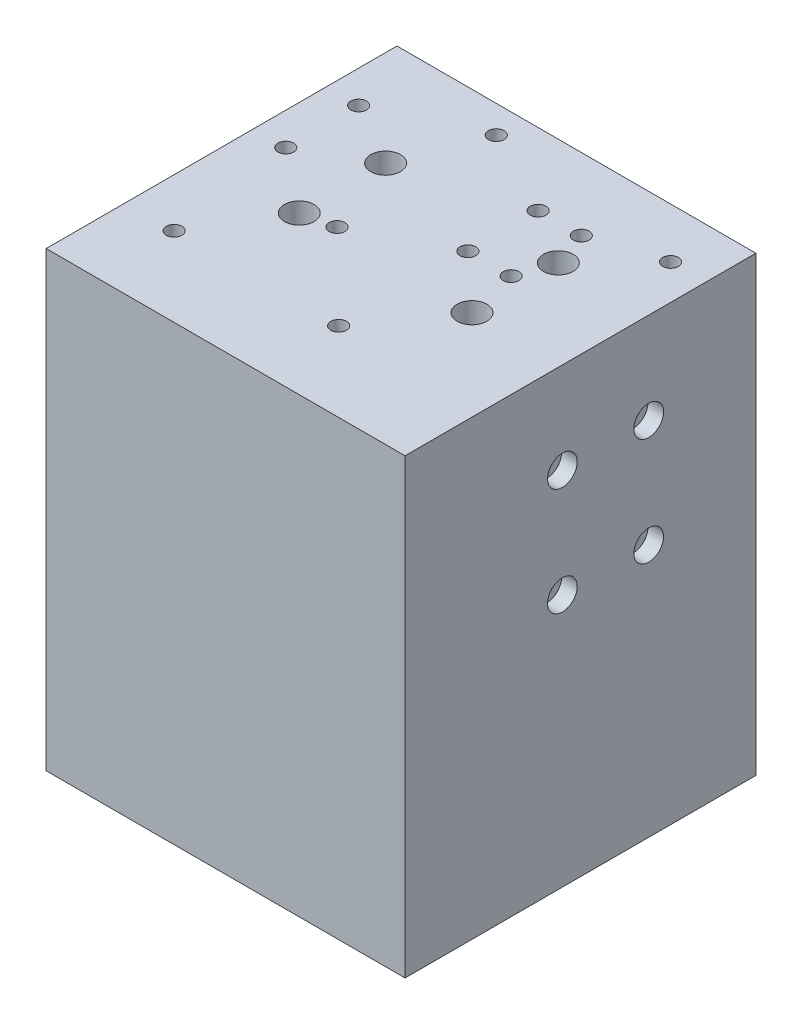
from build123d import *

# Parameters (mm, degrees)
EXTRUDE_1_DEPTH                 = 60
SKETCH_3_W                      = 44.3
SKETCH_3_H                      = 33.8
CUT_EXTRUDE_1_DEPTH             = 56.5
SKETCH_4_W                      = 75
SKETCH_4_H                      = 30
EXTRUDE_2_DEPTH                 = 66
SKETCH_5_W                      = 59.221662283
SKETCH_5_H                      = 50
CUT_EXTRUDE_2_DEPTH             = 65
SKETCH_34_W                     = 75
SKETCH_34_H                     = 30
EXTRUDE_5_DEPTH                 = 0.5
HOLE_WIZARD_M3_1_AT_2_COUNT     = 2
HOLE_WIZARD_M3_1_AT_2_PITCH     = 21
HOLE_WIZARD_M3_1_AT_3_COUNT     = 2
HOLE_WIZARD_M3_1_AT_3_PITCH     = 24.186773245
HOLE_WIZARD_M3_1_AT_4_COUNT     = 2
HOLE_WIZARD_M3_1_AT_4_PITCH     = 12
SKETCH_9_W                      = 201.131722391
SKETCH_9_H                      = 182.70094424
CUT_EXTRUDE_3_DEPTH             = 10
SKETCH_10_W                     = 66.5
SKETCH_10_H                     = 50
CUT_EXTRUDE_4_DEPTH             = 1.2
HOLE_WIZARD_M2_5_1_D            = 2.7
HOLE_WIZARD_M2_5_1_CBORE_D      = 5.5
HOLE_WIZARD_M2_5_1_CBORE_DEPTH  = 2.9
EXTRUDE_3_DEPTH                 = 12
SKETCH_16_W                     = 66.5
SKETCH_16_H                     = 53.8
EXTRUDE_4_DEPTH                 = 3
HOLE_WIZARD_M2_5_2_D            = 2.7
HOLE_WIZARD_M2_5_2_DEPTH        = 10
HOLE_WIZARD_M2_5_2_CBORE_D      = 5.5
HOLE_WIZARD_M2_5_2_CBORE_DEPTH  = 5
HOLE_START                      = -61.2
HOLE_WIZARD_2_9_2_9_1_OUTLINE_R = 1.45
HOLE_WIZARD_2_9_2_9_1_DEPTH     = 10
HOLE_START_2                    = -56.2
HOLE_WIZARD_2_9_2_9_2_OUTLINE_R = 1.45
HOLE_WIZARD_2_9_2_9_2_DEPTH     = 5
HOLE_WIZARD_2_9_2_9_4_D         = 2.9
HOLE_WIZARD_2_9_2_9_4_DEPTH     = 7
HOLE_WIZARD_2_9_2_9_4_TIP       = 0.871247898
CUT_EXTRUDE_5_REACH             = 165.928


# Read off the part's stored shape, not the designer's step: Ø2.9 (2.9) 直径孔1, Ø2.9 (2.9) 直径孔2, Ø2.9 (2.9) 直径孔3
with BuildPart() as part:
    # 草图2 → 凸台-拉伸1 (new body)
    with BuildSketch(Plane.XY):
        Polygon((0, 0), (15.232865332, 0), (15.232865332, -50), (66.5, -50), (66.5, -105), (0, -105), align=None)
    extrude(amount=EXTRUDE_1_DEPTH)

    # 草图3 → 切除-拉伸1 (cut)
    with BuildSketch(Plane.ZY):
        with Locations((37.85, -78.1)):
            Rectangle(SKETCH_3_W, SKETCH_3_H)
    extrude(amount=-CUT_EXTRUDE_1_DEPTH, mode=Mode.SUBTRACT)

    # 草图4 → 凸台-拉伸2 (add)
    with BuildSketch(Plane.ZY):
        with Locations((37.5, -120)):
            Rectangle(SKETCH_4_W, SKETCH_4_H)
    extrude(amount=-EXTRUDE_2_DEPTH)

    # 草图5 → 切除-拉伸2 (cut)
    with BuildSketch(Plane.XY.offset(60)):
        with Locations((-14.37796581, -25)):
            Rectangle(SKETCH_5_W, SKETCH_5_H)
    extrude(amount=-CUT_EXTRUDE_2_DEPTH, mode=Mode.SUBTRACT)

    # 草图34 → 凸台-拉伸5 (add)
    with BuildSketch(Plane(origin=(66, 0, 0), x_dir=(0, 0, -1), z_dir=(1, 0, 0))):
        with Locations((-37.5, -120)):
            Rectangle(SKETCH_34_W, SKETCH_34_H)
    extrude(amount=EXTRUDE_5_DEPTH)

    # 草图8 → M3 六角凹头螺钉的柱形沉头孔1 (revolve, cut)
    with BuildSketch(Plane(origin=(66, -108.3, 54.5), x_dir=(0, 0, -1), z_dir=(0, 1, 0))):
        Polygon((0, 0), (0, 66), (1.45, 66), (1.45, 60), (3.25, 60), (3.25, 0), align=None)
    hole_wizard_m3_1 = revolve(axis=Axis((72.35, -108.3, 54.5), (-1, 0, 0)), mode=Mode.SUBTRACT)

    # M3 六角凹头螺钉的柱形沉头孔1 at 2: M3 六角凹头螺钉的柱形沉头孔1 ×2
    with Locations(*[(0, 0, -i * HOLE_WIZARD_M3_1_AT_2_PITCH) for i in range(1, HOLE_WIZARD_M3_1_AT_2_COUNT)]):
        add(hole_wizard_m3_1, mode=Mode.SUBTRACT)

    # M3 六角凹头螺钉的柱形沉头孔1 at 3: M3 六角凹头螺钉的柱形沉头孔1 ×2
    with Locations(*[Vector(0, -0.4961389383568334, -0.8682431421244595) * (i * HOLE_WIZARD_M3_1_AT_3_PITCH) for i in range(1, HOLE_WIZARD_M3_1_AT_3_COUNT)]):
        add(hole_wizard_m3_1, mode=Mode.SUBTRACT)

    # M3 六角凹头螺钉的柱形沉头孔1 at 4: M3 六角凹头螺钉的柱形沉头孔1 ×2
    with Locations(*[(0, -i * HOLE_WIZARD_M3_1_AT_4_PITCH, 0) for i in range(1, HOLE_WIZARD_M3_1_AT_4_COUNT)]):
        add(hole_wizard_m3_1, mode=Mode.SUBTRACT)

    # 草图9 → 切除-拉伸3 (cut)
    with BuildSketch(Plane(origin=(0, 0, 0), x_dir=(-1, 0, 0), z_dir=(0, 0, -1))):
        with Locations((-9.064738267, -112.548341422)):
            Rectangle(SKETCH_9_W, SKETCH_9_H)
    extrude(amount=-CUT_EXTRUDE_3_DEPTH, mode=Mode.SUBTRACT)

    # 草图10 → 切除-拉伸4 (cut)
    with BuildSketch(Plane(origin=(0, -50, 0), x_dir=(1, 0, 0), z_dir=(0, 1, 0))):
        with Locations((33.25, -35)):
            Rectangle(SKETCH_10_W, SKETCH_10_H)
    extrude(amount=-CUT_EXTRUDE_4_DEPTH, mode=Mode.SUBTRACT)

    # M2.5 六角凹头螺钉的柱形沉头孔1 (through all)
    with Locations(Plane(origin=(66.5, 0, 0), x_dir=(0, 0, -1), z_dir=(1, 0, 0))):
        with Locations((-29.85, -68.1), (-45.85, -68.1), (-45.85, -88.1), (-29.85, -88.1)):
            CounterBoreHole(HOLE_WIZARD_M2_5_1_D / 2, HOLE_WIZARD_M2_5_1_CBORE_D / 2, HOLE_WIZARD_M2_5_1_CBORE_DEPTH)

    # 草图15 → 凸台-拉伸3 (add)
    with BuildSketch(Plane.XY.offset(60)):
        Polygon((66.5, -105), (66.5, -51.2), (0, -51.2), (0, -56.2), (46.5, -56.2), (46.5, -100), (0, -100), (0, -105), align=None)
    extrude(amount=EXTRUDE_3_DEPTH)

    # 草图16 → 凸台-拉伸4 (add)
    with BuildSketch(Plane.XY.offset(72)):
        with Locations((33.25, -78.1)):
            Rectangle(SKETCH_16_W, SKETCH_16_H)
    extrude(amount=EXTRUDE_4_DEPTH)

    # M2.5 六角凹头螺钉的柱形沉头孔2
    with Locations(Plane(origin=(0, -51.2, 0), x_dir=(1, 0, 0), z_dir=(0, 1, 0))):
        with Locations((17.75, -45.85), (17.75, -29.85), (49.75, -29.85), (49.75, -45.85)):
            CounterBoreHole(HOLE_WIZARD_M2_5_2_D / 2, HOLE_WIZARD_M2_5_2_CBORE_D / 2, HOLE_WIZARD_M2_5_2_CBORE_DEPTH, depth=HOLE_WIZARD_M2_5_2_DEPTH)

    # Ø2.9 (2.9) 直径孔1 outline → Ø2.9 (2.9) 直径孔1 (cut)
    with BuildSketch(Plane(origin=(0, 0, 0), x_dir=(1, 0, 0), z_dir=(0, 1, 0)).offset(HOLE_START)):
        with Locations((39.499246981, -23.35)):
            Circle(HOLE_WIZARD_2_9_2_9_1_OUTLINE_R)
        with Locations((47.499246981, -36.35)):
            Circle(HOLE_WIZARD_2_9_2_9_1_OUTLINE_R)
        with Locations((47.499246981, -23.35)):
            Circle(HOLE_WIZARD_2_9_2_9_1_OUTLINE_R)
        with Locations((39.499246981, -36.35)):
            Circle(HOLE_WIZARD_2_9_2_9_1_OUTLINE_R)
        with Locations((23.5, -44.6)):
            Circle(HOLE_WIZARD_2_9_2_9_1_OUTLINE_R)
        with Locations((23.5, -15.1)):
            Circle(HOLE_WIZARD_2_9_2_9_1_OUTLINE_R)
        with Locations((6, -23.1)):
            Circle(HOLE_WIZARD_2_9_2_9_1_OUTLINE_R)
        with Locations((6, -36.6)):
            Circle(HOLE_WIZARD_2_9_2_9_1_OUTLINE_R)
    extrude(amount=HOLE_WIZARD_2_9_2_9_1_DEPTH, mode=Mode.SUBTRACT)

    # Ø2.9 (2.9) 直径孔2 outline → Ø2.9 (2.9) 直径孔2 (cut)
    with BuildSketch(Plane(origin=(0, 0, 0), x_dir=(1, 0, 0), z_dir=(0, 1, 0)).offset(HOLE_START_2)):
        with Locations((39.5, -60.3)):
            Circle(HOLE_WIZARD_2_9_2_9_2_OUTLINE_R)
        with Locations((9, -60.3)):
            Circle(HOLE_WIZARD_2_9_2_9_2_OUTLINE_R)
    extrude(amount=HOLE_WIZARD_2_9_2_9_2_DEPTH, mode=Mode.SUBTRACT)

    # Ø2.9 (2.9) 直径孔3 outline → Ø2.9 (2.9) 直径孔3 (revolve, cut)
    with BuildSketch(Plane(origin=(59.999246981, 0, 19.3), x_dir=(1, 0, 0), z_dir=(0, 0, 1))):
        Polygon((0, -51.2), (0, -62.071247898), (1.45, -61.2), (1.45, -51.2), align=None)
    revolve(axis=Axis((59.999246981, 0, 19.3), (0, 1, 0)), mode=Mode.SUBTRACT)

    # Ø2.9 (2.9) 直径孔4
    with Locations(Plane(origin=(0, -135, 0), x_dir=(-1, 0, 0), z_dir=(0, -1, 0))):
        with Locations((-23.5, -15.1), (-39.499246981, -23.35), (-47.499246981, -23.35), (-59.999246981, -19.3), (-47.499246981, -36.35), (-39.499246981, -36.35), (-39.5, -60.3), (-23.5, -44.6), (-6, -36.6), (-6, -23.1), (-9, -60.3)):
            Hole(HOLE_WIZARD_2_9_2_9_4_D / 2, depth=HOLE_WIZARD_2_9_2_9_4_DEPTH)
            with Locations((0, 0, -(HOLE_WIZARD_2_9_2_9_4_DEPTH + HOLE_WIZARD_2_9_2_9_4_TIP / 2))):  # 118° drill point
                Cone(0, HOLE_WIZARD_2_9_2_9_4_D / 2, HOLE_WIZARD_2_9_2_9_4_TIP, mode=Mode.SUBTRACT)

    # 切除-拉伸5: up to this face of the body (flat: up to its plane)
    cut_extrude_5_end = Plane(part.part.faces().sort_by_distance((28.25, -78.1, 15.7))[0])
    # 草图33 → 切除-拉伸5 (cut, up to the picked face)
    with BuildSketch(Plane(origin=(0, 0, 10), x_dir=(-1, 0, 0), z_dir=(0, 0, -1)), mode=Mode.PRIVATE) as cut_extrude_5_sk1:
        Polygon((-21, -61.1), (-37, -61.1), (-34.176470588, -67.1), (-21, -67.1), align=None)
    cut_extrude_5_tool1 = split(extrude(cut_extrude_5_sk1.sketch, amount=-CUT_EXTRUDE_5_REACH, mode=Mode.PRIVATE), bisect_by=cut_extrude_5_end, keep=Keep.BOTH, mode=Mode.PRIVATE)
    # 草图33 → 切除-拉伸5 (cut, up to the picked face)
    with BuildSketch(Plane(origin=(0, 0, 10), x_dir=(-1, 0, 0), z_dir=(0, 0, -1)), mode=Mode.PRIVATE) as cut_extrude_5_sk2:
        Polygon((-23.823529412, -89.1), (-37, -89.1), (-37, -95.1), (-21, -95.1), align=None)
    cut_extrude_5_tool2 = split(extrude(cut_extrude_5_sk2.sketch, amount=-CUT_EXTRUDE_5_REACH, mode=Mode.PRIVATE), bisect_by=cut_extrude_5_end, keep=Keep.BOTH, mode=Mode.PRIVATE)
    # 草图33 → 切除-拉伸5 (cut, up to the picked face)
    with BuildSketch(Plane(origin=(0, 0, 10), x_dir=(-1, 0, 0), z_dir=(0, 0, -1)), mode=Mode.PRIVATE) as cut_extrude_5_sk3:
        Polygon((-21, -89.1), (-23.823529412, -89.1), (-21, -95.1), align=None)
    cut_extrude_5_tool3 = split(extrude(cut_extrude_5_sk3.sketch, amount=-CUT_EXTRUDE_5_REACH, mode=Mode.PRIVATE), bisect_by=cut_extrude_5_end, keep=Keep.BOTH, mode=Mode.PRIVATE)
    # 草图33 → 切除-拉伸5 (cut, up to the picked face)
    with BuildSketch(Plane(origin=(0, 0, 10), x_dir=(-1, 0, 0), z_dir=(0, 0, -1)), mode=Mode.PRIVATE) as cut_extrude_5_sk4:
        Polygon((-34.176470588, -67.1), (-37, -61.1), (-37, -67.1), align=None)
    cut_extrude_5_tool4 = split(extrude(cut_extrude_5_sk4.sketch, amount=-CUT_EXTRUDE_5_REACH, mode=Mode.PRIVATE), bisect_by=cut_extrude_5_end, keep=Keep.BOTH, mode=Mode.PRIVATE)
    add(cut_extrude_5_tool1.solids().sort_by(Axis((28.316888, -64.003226, 10), (0, 0, 1)))[0], mode=Mode.SUBTRACT)
    add(cut_extrude_5_tool2.solids().sort_by(Axis((29.683112, -92.196774, 10), (0, 0, 1)))[0], mode=Mode.SUBTRACT)
    add(cut_extrude_5_tool3.solids().sort_by(Axis((21.941176, -91.1, 10), (0, 0, 1)))[0], mode=Mode.SUBTRACT)
    add(cut_extrude_5_tool4.solids().sort_by(Axis((36.058824, -65.1, 10), (0, 0, 1)))[0], mode=Mode.SUBTRACT)


solid = part.part
